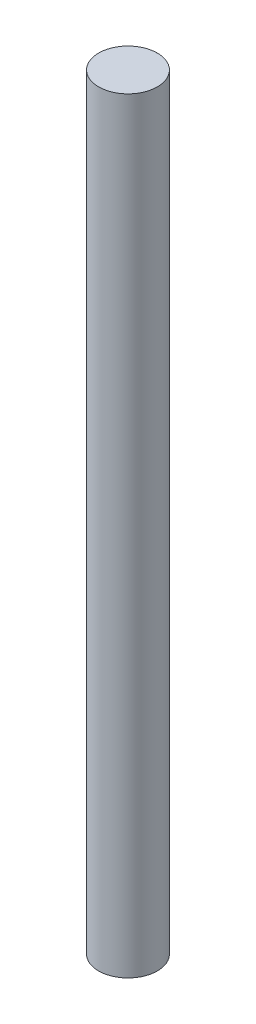
from build123d import *

# Parameters (mm, degrees)
SKETCH1_R           = 2
BOSS_EXTRUDE1_DEPTH = 52.2


with BuildPart() as part:
    # Sketch1 → Boss-Extrude1 (new body)
    with BuildSketch(Plane(origin=(0, 0, 0), x_dir=(1, 0, 0), z_dir=(0, 1, 0))):
        Circle(SKETCH1_R)
    extrude(amount=BOSS_EXTRUDE1_DEPTH)


solid = part.part
